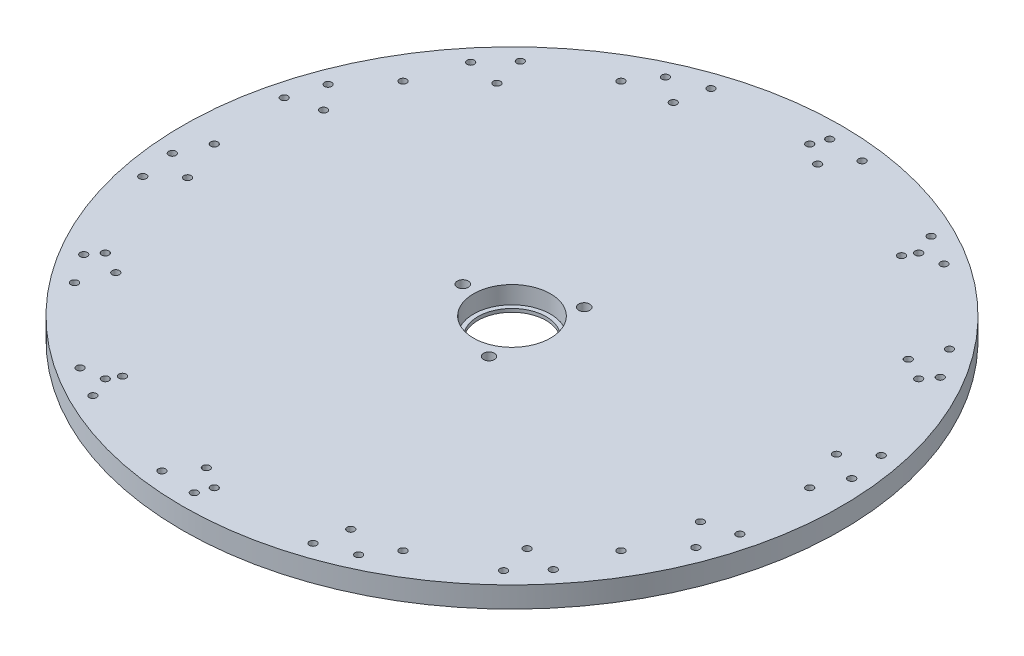
from build123d import *

# Parameters (mm, degrees)
SKETCH1_R           = 150
BOSS_EXTRUDE1_DEPTH = 9.52
SKETCH2_R           = 15.5
CUT_EXTRUDE1_DEPTH  = 213.345544808
SKETCH3_R           = 17.505
CUT_EXTRUDE2_DEPTH  = 8
SKETCH4_R           = 2.5
SKETCH4_R_2         = 1.65
CUT_EXTRUDE3_DEPTH  = 213.345544808
SKETCH6_R           = 1.65
CUT_EXTRUDE5_DEPTH  = 213.345544808


with BuildPart() as part:
    # Sketch1 → Boss-Extrude1 (new body)
    with BuildSketch(Plane(origin=(0, 0, 0), x_dir=(1, 0, 0), z_dir=(0, 1, 0))):
        Circle(SKETCH1_R)
    extrude(amount=BOSS_EXTRUDE1_DEPTH)

    # Sketch2 → Cut-Extrude1 (cut, through all)
    with BuildSketch(Plane(origin=(0, 9.52, 0), x_dir=(1, 0, 0), z_dir=(0, 1, 0))):
        Circle(SKETCH2_R)
    extrude(amount=-CUT_EXTRUDE1_DEPTH, mode=Mode.SUBTRACT)

    # Sketch3 → Cut-Extrude2 (cut)
    with BuildSketch(Plane(origin=(0, 9.52, 0), x_dir=(1, 0, 0), z_dir=(0, 1, 0))):
        Circle(SKETCH3_R)
    extrude(amount=-CUT_EXTRUDE2_DEPTH, mode=Mode.SUBTRACT)

    # Sketch4 → Cut-Extrude3 (cut, through all)
    with BuildSketch(Plane(origin=(0, 9.52, 0), x_dir=(1, 0, 0), z_dir=(0, 1, 0))):
        with Locations((10.725147849, -21.193217308)):
            Circle(SKETCH4_R)
        with Locations((-23.716438501, 1.308358157)):
            Circle(SKETCH4_R)
        with Locations((12.991290652, 19.884859151)):
            Circle(SKETCH4_R)
        with Locations((67.75, -117.346442213)):
            Circle(SKETCH4_R_2)
        with Locations((0, -135.5)):
            Circle(SKETCH4_R_2)
        with Locations((-67.75, -117.346442213)):
            Circle(SKETCH4_R_2)
        with Locations((-117.346442213, -67.75)):
            Circle(SKETCH4_R_2)
        with Locations((-135.5, 0)):
            Circle(SKETCH4_R_2)
        with Locations((-117.346442213, 67.75)):
            Circle(SKETCH4_R_2)
        with Locations((-67.75, 117.346442213)):
            Circle(SKETCH4_R_2)
        with Locations((0, 135.5)):
            Circle(SKETCH4_R_2)
        with Locations((67.75, 117.346442213)):
            Circle(SKETCH4_R_2)
        with Locations((117.346442213, 67.75)):
            Circle(SKETCH4_R_2)
        with Locations((135.5, 0)):
            Circle(SKETCH4_R_2)
        with Locations((117.346442213, -67.75)):
            Circle(SKETCH4_R_2)
    extrude(amount=-CUT_EXTRUDE3_DEPTH, mode=Mode.SUBTRACT)

    # Sketch6 → Cut-Extrude5 (cut, through all)
    with BuildSketch(Plane(origin=(0, 0, 0), x_dir=(-1, 0, 0), z_dir=(0, -1, 0))):
        with Locations((-63.964762127, 126.790217897)):
            Circle(SKETCH6_R)
        with Locations((-77.821168587, 118.790217897)):
            Circle(SKETCH6_R)
        with Locations((-64.892965357, 112.397913052)):
            Circle(SKETCH6_R)
        with Locations((-9.698914748, 129.423022928)):
            Circle(SKETCH6_R)
        with Locations((-2.618045494, 141.987309243)):
            Circle(SKETCH6_R)
        with Locations((-18.573306249, 140.791627746)):
            Circle(SKETCH6_R)
        with Locations((59.247207157, 129.062072633)):
            Circle(SKETCH6_R)
        with Locations((44.353227178, 134.907529023)):
            Circle(SKETCH6_R)
        with Locations((47.416124875, 120.814315845)):
            Circle(SKETCH6_R)
        with Locations((109.377823811, 90.574509696)):
            Circle(SKETCH6_R)
        with Locations((98.495060007, 102.303339645)):
            Circle(SKETCH6_R)
        with Locations((95.139819447, 88.276851818)):
            Circle(SKETCH6_R)
        with Locations((133.128738238, 49.436719183)):
            Circle(SKETCH6_R)
        with Locations((124.019905964, 38.255074644)):
            Circle(SKETCH6_R)
        with Locations((137.844821028, 34.14755429)):
            Circle(SKETCH6_R)
        with Locations((141.394637144, -13.221449816)):
            Circle(SKETCH6_R)
        with Locations((128.3363291, -19.343589231)):
            Circle(SKETCH6_R)
        with Locations((139.009960885, -29.042743035)):
            Circle(SKETCH6_R)
        with Locations((121.655594073, -73.260948528)):
            Circle(SKETCH6_R)
        with Locations((112.642473144, -86.480768917)):
            Circle(SKETCH6_R)
        with Locations((107.234168316, -73.111018025)):
            Circle(SKETCH6_R)
        with Locations((64.892965357, -112.397913052)):
            Circle(SKETCH6_R)
        with Locations((63.964762127, -126.790217897)):
            Circle(SKETCH6_R)
        with Locations((77.821168587, -118.790217897)):
            Circle(SKETCH6_R)
        with Locations((9.698914748, -129.423022928)):
            Circle(SKETCH6_R)
        with Locations((2.618045494, -141.987309243)):
            Circle(SKETCH6_R)
        with Locations((18.573306249, -140.791627746)):
            Circle(SKETCH6_R)
        with Locations((-44.353227178, -134.907529023)):
            Circle(SKETCH6_R)
        with Locations((-59.247207157, -129.062072633)):
            Circle(SKETCH6_R)
        with Locations((-47.416124875, -120.814315845)):
            Circle(SKETCH6_R)
        with Locations((-98.495060007, -102.303339645)):
            Circle(SKETCH6_R)
        with Locations((-109.377823811, -90.574509696)):
            Circle(SKETCH6_R)
        with Locations((-95.139819447, -88.276851818)):
            Circle(SKETCH6_R)
        with Locations((-124.019905964, -38.255074644)):
            Circle(SKETCH6_R)
        with Locations((-137.844821028, -34.14755429)):
            Circle(SKETCH6_R)
        with Locations((-133.128738238, -49.436719183)):
            Circle(SKETCH6_R)
        with Locations((-128.3363291, 19.343589231)):
            Circle(SKETCH6_R)
        with Locations((-141.394637144, 13.221449816)):
            Circle(SKETCH6_R)
        with Locations((-139.009960885, 29.042743035)):
            Circle(SKETCH6_R)
        with Locations((-107.234168316, 73.111018025)):
            Circle(SKETCH6_R)
        with Locations((-121.655594073, 73.260948528)):
            Circle(SKETCH6_R)
        with Locations((-112.642473144, 86.480768917)):
            Circle(SKETCH6_R)
    extrude(amount=-CUT_EXTRUDE5_DEPTH, mode=Mode.SUBTRACT)


solid = part.part
